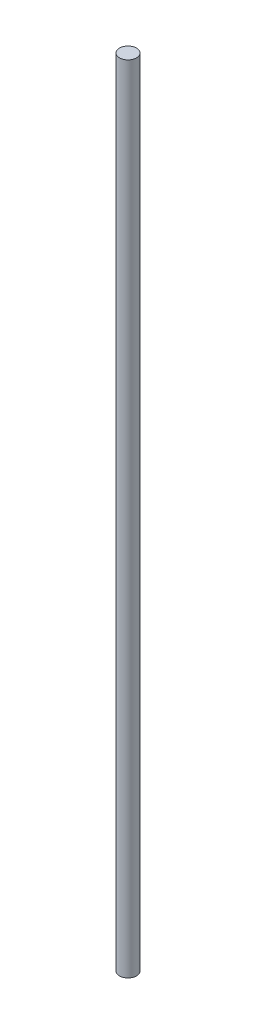
from build123d import *

# Parameters (mm, degrees)
SKETCH_1_R      = 1.5
EXTRUDE_1_DEPTH = 140


with BuildPart() as part:
    # 草图1 → 凸台-拉伸1 (new body)
    with BuildSketch(Plane(origin=(0, 0, 0), x_dir=(1, 0, 0), z_dir=(0, 1, 0))):
        Circle(SKETCH_1_R)
    extrude(amount=EXTRUDE_1_DEPTH)


solid = part.part
